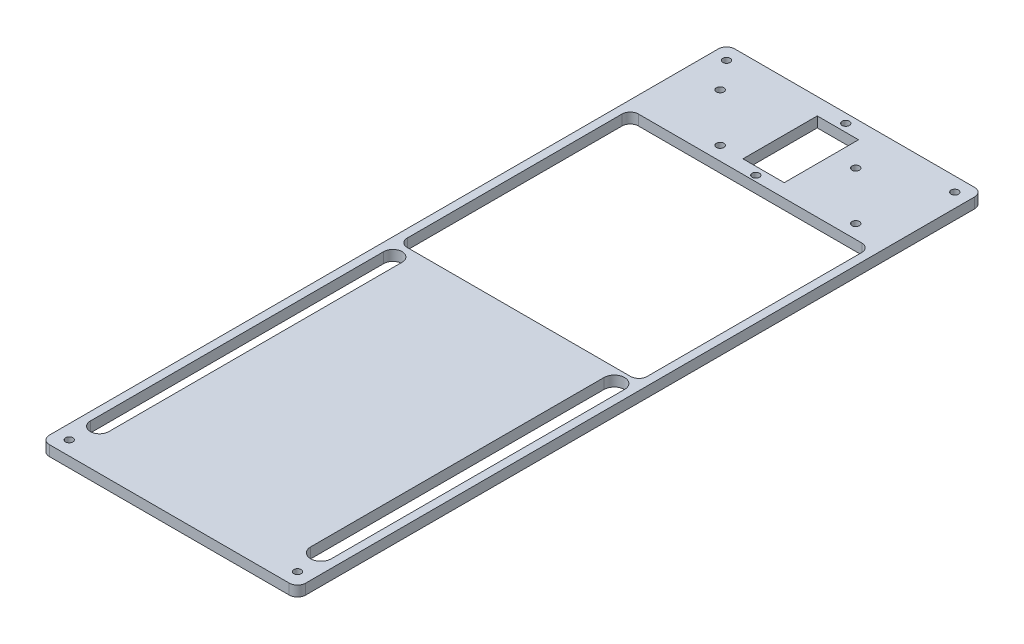
from build123d import *

# Parameters (mm, degrees)
SKETCH2_W           = 78.8444702
SKETCH2_H           = 3.2004
BOSS_EXTRUDE1_DEPTH = 210.82
SKETCH3_R           = 1.1303
SKETCH3_R_2         = 1.143
SKETCH3_W           = 12.7
SKETCH3_H           = 22.86
SKETCH3_W_2         = 73.7644702
SKETCH3_H_2         = 71.12
CUT_EXTRUDE1_DEPTH  = 216.478809771
FILLET1_R           = 2.54
FILLET2_R           = 2.54


with BuildPart() as part:
    # Sketch2 → Boss-Extrude1 (new body)
    with BuildSketch(Plane.XY):
        with Locations((-5.0277649, -1.6002)):
            Rectangle(SKETCH2_W, SKETCH2_H)
    extrude(amount=BOSS_EXTRUDE1_DEPTH)

    # Sketch3 → Cut-Extrude1 (cut, through all)
    with BuildSketch(Plane.XZ.offset(3.2004)):
        with Locations((-40.132, 206.502)):
            Circle(SKETCH3_R)
        with Locations((30.0764702, 206.502)):
            Circle(SKETCH3_R)
        with Locations((-40.132, 4.318)):
            Circle(SKETCH3_R)
        with Locations((30.0764702, 4.318)):
            Circle(SKETCH3_R)
        with Locations((-5.0277649, 30.425887591)):
            Circle(SKETCH3_R)
        with Locations((-5.0277649, 2.765287591)):
            Circle(SKETCH3_R)
        with Locations((23.2108502, 27.94)):
            Circle(SKETCH3_R_2)
        with Locations((8.424210122, 13.153359922)):
            Circle(SKETCH3_R_2)
        with Locations((-18.479739922, 27.94)):
            Circle(SKETCH3_R_2)
        with Locations((-33.26638, 13.153359922)):
            Circle(SKETCH3_R_2)
        with BuildLine():
            Line((-41.91, 107.997412352), (-41.91, 198.224041398))
            ThreePointArc((-41.91, 198.224041398), (-39.076175505, 201.057865893), (-36.24235101, 198.224041398))
            Line((-36.24235101, 198.224041398), (-36.24235101, 107.997412352))
            ThreePointArc((-36.24235101, 107.997412352), (-39.076175505, 105.163587857), (-41.91, 107.997412352))
        make_face()
        with BuildLine():
            Line((25.5044702, 107.656236847), (25.5044702, 197.882865893))
            ThreePointArc((25.5044702, 197.882865893), (28.6794702, 201.057865893), (31.8544702, 197.882865893))
            Line((31.8544702, 197.882865893), (31.8544702, 107.656236847))
            ThreePointArc((31.8544702, 107.656236847), (28.6794702, 104.481236847), (25.5044702, 107.656236847))
        make_face()
        with Locations((-5.0277649, 16.595587591)):
            Rectangle(SKETCH3_W, SKETCH3_H)
        with Locations((-5.0277649, 67.718344583)):
            Rectangle(SKETCH3_W_2, SKETCH3_H_2)
    extrude(amount=-CUT_EXTRUDE1_DEPTH, mode=Mode.SUBTRACT)

    # Fillet1
    fillet1_edges = [part.edges().sort_by_distance(p)[0] for p in [
        (34.3944702, -1.6002, 210.82),
        (-44.45, -1.6002, 210.82),
        (-44.45, -1.6002, 0),
        (34.3944702, -1.6002, 0),
    ]]
    fillet(fillet1_edges, radius=FILLET1_R)

    # Fillet2
    fillet2_edges = [part.edges().sort_by_distance(p)[0] for p in [
        (31.8544702, -1.6002, 103.278344583),
        (-41.91, -1.6002, 103.278344583),
        (-41.91, -1.6002, 32.158344583),
        (31.8544702, -1.6002, 32.158344583),
    ]]
    fillet(fillet2_edges, radius=FILLET2_R)


solid = part.part
